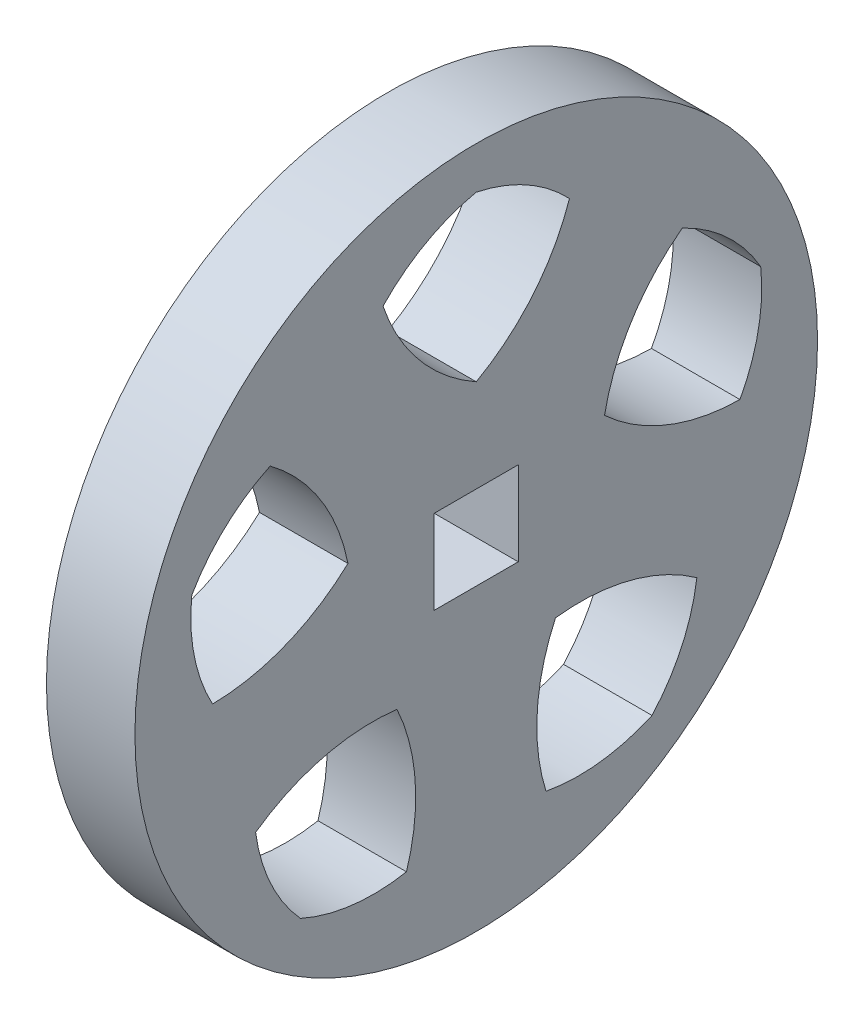
from build123d import *

# Parameters (mm, degrees)
SKETCH1_R           = 13.5
BOSS_EXTRUDE1_DEPTH = 3.5
CUT_EXTRUDE1_REACH  = 21.41
CIRPATTERN1_COUNT   = 5
CUT_EXTRUDE2_REACH  = 21.41
SKETCH3_W           = 3.323401872
SKETCH3_H           = 3.323401872


with BuildPart() as part:
    # Sketch1 → Boss-Extrude1 (new body)
    with BuildSketch(Plane(origin=(0, 0, 0), x_dir=(0, 0, -1), z_dir=(1, 0, 0))):
        Circle(SKETCH1_R)
    extrude(amount=BOSS_EXTRUDE1_DEPTH)

    # Sketch2 → Cut-Extrude1 (cut, up to next)
    with BuildSketch(Plane(origin=(0, 0, 0), x_dir=(0, 0, -1), z_dir=(1, 0, 0)), mode=Mode.PRIVATE) as cut_extrude1_sk1:
        with BuildLine():
            ThreePointArc((0, 5.335224169), (-2.256377168, 7.208861271), (-3.687303072, 9.768979428))
            ThreePointArc((-3.687303072, 9.768979428), (-2.000654027, 11.080188439), (0, 11.829479796))
            ThreePointArc((0, 11.829479796), (2.000654027, 11.080188439), (3.687303072, 9.768979428))
            ThreePointArc((3.687303072, 9.768979428), (2.256377168, 7.208861271), (0, 5.335224169))
        make_face()
    cut_extrude1_tool1 = extrude(cut_extrude1_sk1.sketch, amount=CUT_EXTRUDE1_REACH, mode=Mode.PRIVATE) & part.part
    cut_extrude1 = cut_extrude1_tool1.solids().sort_by_distance((0, 8.878443, 0))[0]
    add(cut_extrude1, mode=Mode.SUBTRACT)

    # CirPattern1: Cut-Extrude1 ×5 about axis
    cirpattern1_axis = Axis((3.5, 0, 0), (-1, 0, 0))
    for i in range(1, CIRPATTERN1_COUNT):
        add(cut_extrude1.rotate(cirpattern1_axis, i * 360 / CIRPATTERN1_COUNT), mode=Mode.SUBTRACT)

    # Sketch3 → Cut-Extrude2 (cut, up to next)
    with BuildSketch(Plane(origin=(0, 0, 0), x_dir=(0, 0, -1), z_dir=(1, 0, 0)), mode=Mode.PRIVATE) as cut_extrude2_sk1:
        Rectangle(SKETCH3_W, SKETCH3_H)
    cut_extrude2_tool1 = extrude(cut_extrude2_sk1.sketch, amount=CUT_EXTRUDE2_REACH, mode=Mode.PRIVATE) & part.part
    add(cut_extrude2_tool1.solids().sort_by_distance((0, 0, 0))[0], mode=Mode.SUBTRACT)


solid = part.part
